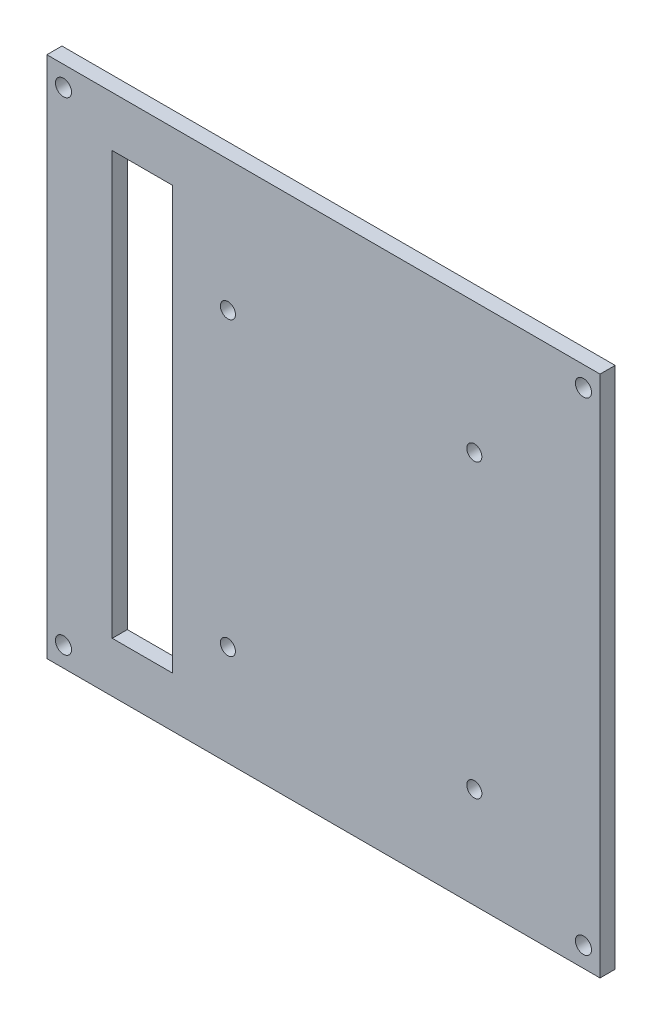
from build123d import *

# Parameters (mm, degrees)
CROQUIS1_W                   = 110
CROQUIS1_H                   = 92
SALIENTE_EXTRUIR1_DEPTH      = 3
CROQUIS7_W                   = 110
CROQUIS7_H                   = 3
SALIENTE_EXTRUIR2_DEPTH      = 6
CROQUIS8_W                   = 110
CROQUIS8_H                   = 3
SALIENTE_EXTRUIR3_DEPTH      = 6
TALADRO_DE_MARGEN_PARA_M31_D = 3.2
CORTAR_EXTRUIR2_REACH        = 142.901
CROQUIS13_R                  = 1.5
CORTAR_EXTRUIR3_REACH        = 142.901
CROQUIS14_W                  = 12
CROQUIS14_H                  = 84


with BuildPart() as part:
    # Croquis1 → Saliente-Extruir1 (new body)
    with BuildSketch(Plane.XY):
        with Locations((55, 36)):
            Rectangle(CROQUIS1_W, CROQUIS1_H)
    extrude(amount=SALIENTE_EXTRUIR1_DEPTH)

    # Croquis7 → Saliente-Extruir2 (add)
    with BuildSketch(Plane(origin=(0, 82, 0), x_dir=(1, 0, 0), z_dir=(0, 1, 0))):
        with Locations((55, -1.5)):
            Rectangle(CROQUIS7_W, CROQUIS7_H)
    extrude(amount=SALIENTE_EXTRUIR2_DEPTH)

    # Croquis8 → Saliente-Extruir3 (add)
    with BuildSketch(Plane.XZ.offset(10)):
        with Locations((55, 1.5)):
            Rectangle(CROQUIS8_W, CROQUIS8_H)
    extrude(amount=SALIENTE_EXTRUIR3_DEPTH)

    # Taladro de margen para M31 (through all)
    with Locations(Plane(origin=(3.3, 84, 3), x_dir=(1, 0, 0), z_dir=(0, 0, 1))):
        with Locations((0, 0), (0, -96), (103.4, -96), (103.4, 0)):
            Hole(TALADRO_DE_MARGEN_PARA_M31_D / 2)

    # Croquis13 → Cortar-Extruir2 (cut, up to next)
    with BuildSketch(Plane.XY.offset(3), mode=Mode.PRIVATE) as cortar_extruir2_sk1:
        with Locations((36, 62)):
            Circle(CROQUIS13_R)
    cortar_extruir2_tool1 = extrude(cortar_extruir2_sk1.sketch, amount=-CORTAR_EXTRUIR2_REACH, mode=Mode.PRIVATE) & part.part
    # Croquis13 → Cortar-Extruir2 (cut, up to next)
    with BuildSketch(Plane.XY.offset(3), mode=Mode.PRIVATE) as cortar_extruir2_sk2:
        with Locations((85, 62)):
            Circle(CROQUIS13_R)
    cortar_extruir2_tool2 = extrude(cortar_extruir2_sk2.sketch, amount=-CORTAR_EXTRUIR2_REACH, mode=Mode.PRIVATE) & part.part
    # Croquis13 → Cortar-Extruir2 (cut, up to next)
    with BuildSketch(Plane.XY.offset(3), mode=Mode.PRIVATE) as cortar_extruir2_sk3:
        with Locations((36, 4)):
            Circle(CROQUIS13_R)
    cortar_extruir2_tool3 = extrude(cortar_extruir2_sk3.sketch, amount=-CORTAR_EXTRUIR2_REACH, mode=Mode.PRIVATE) & part.part
    # Croquis13 → Cortar-Extruir2 (cut, up to next)
    with BuildSketch(Plane.XY.offset(3), mode=Mode.PRIVATE) as cortar_extruir2_sk4:
        with Locations((85, 4)):
            Circle(CROQUIS13_R)
    cortar_extruir2_tool4 = extrude(cortar_extruir2_sk4.sketch, amount=-CORTAR_EXTRUIR2_REACH, mode=Mode.PRIVATE) & part.part
    add(cortar_extruir2_tool1.solids().sort_by_distance((36, 62, 3))[0], mode=Mode.SUBTRACT)
    add(cortar_extruir2_tool2.solids().sort_by_distance((85, 62, 3))[0], mode=Mode.SUBTRACT)
    add(cortar_extruir2_tool3.solids().sort_by_distance((36, 4, 3))[0], mode=Mode.SUBTRACT)
    add(cortar_extruir2_tool4.solids().sort_by_distance((85, 4, 3))[0], mode=Mode.SUBTRACT)

    # Croquis14 → Cortar-Extruir3 (cut, up to next)
    with BuildSketch(Plane.XY.offset(3), mode=Mode.PRIVATE) as cortar_extruir3_sk1:
        with Locations((19, 36)):
            Rectangle(CROQUIS14_W, CROQUIS14_H)
    cortar_extruir3_tool1 = extrude(cortar_extruir3_sk1.sketch, amount=-CORTAR_EXTRUIR3_REACH, mode=Mode.PRIVATE) & part.part
    add(cortar_extruir3_tool1.solids().sort_by_distance((19, 36, 3))[0], mode=Mode.SUBTRACT)


solid = part.part
